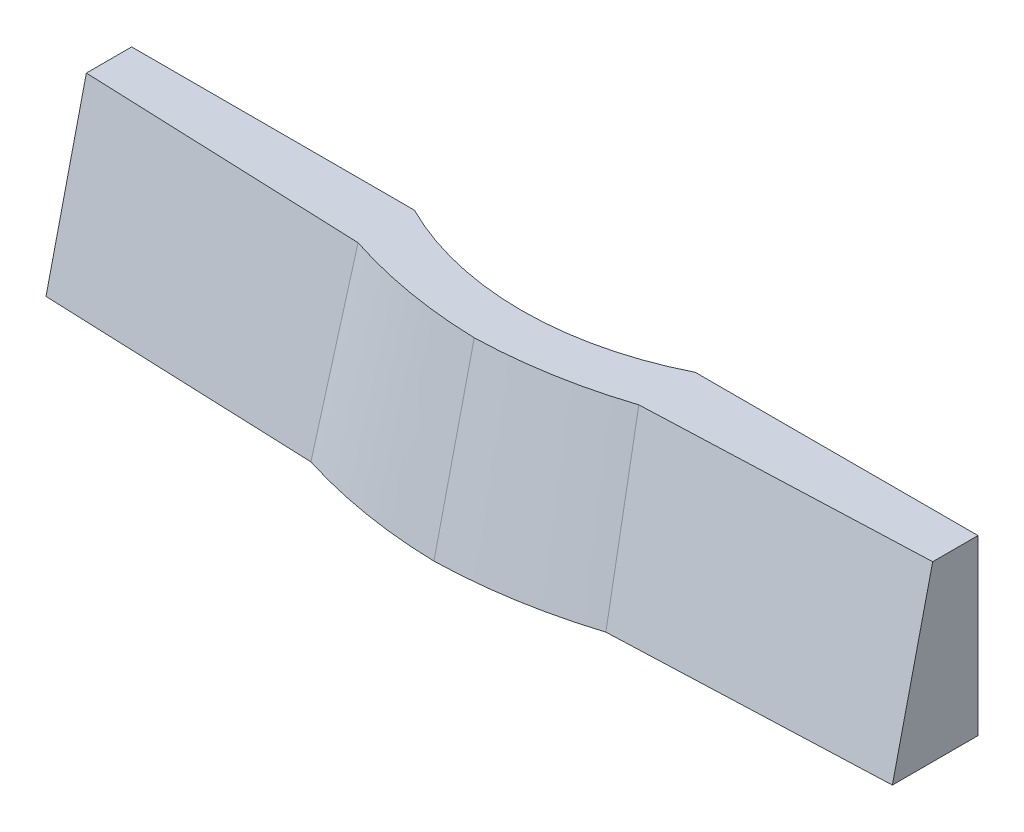
from build123d import *


with BuildPart() as part:
    # Sketch2 for Loft2 → Loft2 section 0
    with BuildSketch(Plane(origin=(0, -25, 0), x_dir=(1, 0, 0), z_dir=(0, 1, 0))):
        with BuildLine():
            Line((-105, -30), (-105, -51.249843401))
            Line((-105, -51.249843401), (-36.594132523, -53.927861178))
            # circular arc as an exact rational Bezier (weights 1, cos(half-angle), 1)
            Bezier((-36.594132523, -53.927861178), (-18.726691655, -59.553325763), (0, -60.003119775), weights=[1, 0.990145747, 1])
            Bezier((0, -60.003119775), (18.726691655, -59.553325763), (36.594132523, -53.927861178), weights=[1, 0.990145747, 1])
            Line((36.594132523, -53.927861178), (105, -51.249843401))
            Line((105, -51.249843401), (105, -30))
            Line((105, -30), (34.839914339, -30))
            Bezier((34.839914339, -30), (0, -47.505078901), (-34.839914339, -30), weights=[1, 0.893552226, 1])
            Line((-34.839914339, -30), (-105, -30))
        make_face()
    # Sketch3 for Loft2 → Loft2 section 1
    with BuildSketch(Plane(origin=(0, 18, 0), x_dir=(1, 0, 0), z_dir=(0, 1, 0))):
        with BuildLine():
            Line((-105, -30), (-34.839914339, -30))
            Bezier((-34.839914339, -30), (0, -47.505078901), (34.839914339, -30), weights=[1, 0.893552226, 1])
            Line((34.839914339, -30), (105, -30))
            Line((105, -30), (105, -41.242183134))
            Line((105, -41.242183134), (34.839914339, -43.988876709))
            Bezier((34.839914339, -43.988876709), (17.858467792, -49.536005345), (0, -50), weights=[1, 0.989523598, 1])
            Bezier((0, -50), (-17.858467792, -49.536005345), (-34.839914339, -43.988876709), weights=[1, 0.989523598, 1])
            Line((-34.839914339, -43.988876709), (-105, -41.242183134))
            Line((-105, -41.242183134), (-105, -30))
        make_face()
    loft()


solid = part.part
